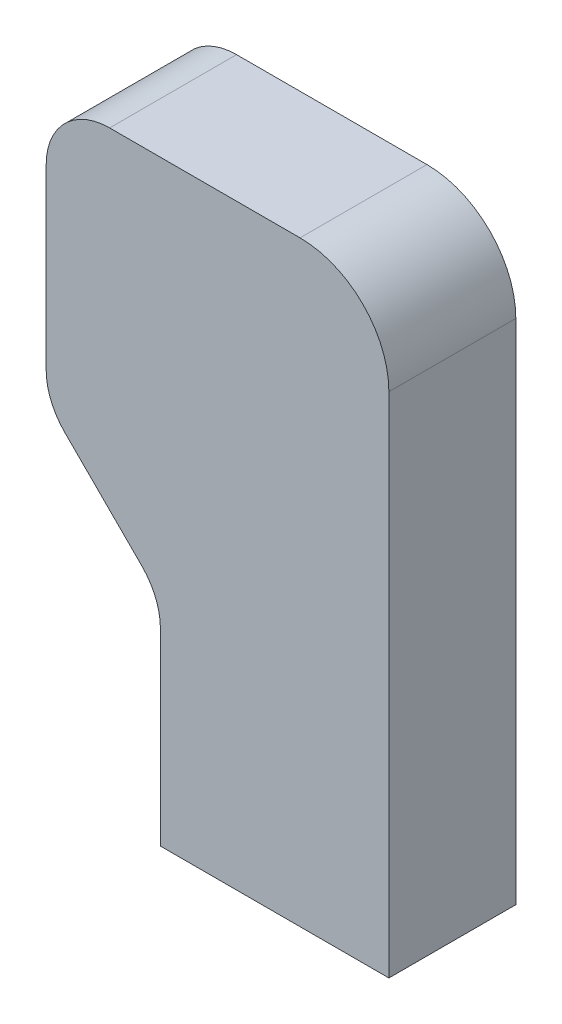
from build123d import *

# Parameters (mm, degrees)
BOSS_EXTRUDE1_DEPTH = 0.635
SKETCH2_W           = 1.27
SKETCH2_H           = 0.76
CUT_EXTRUDE1_DEPTH  = 4.74
FILLET1_R           = 0.635


with BuildPart() as part:
    # Sketch1 → Boss-Extrude1 (new, symmetric)
    with BuildSketch(Plane.XY):
        with BuildLine():
            Line((146.298402351, 141.127858501), (147.069427963, 140.356832889))
            ThreePointArc((147.069427963, 140.356832889), (147.20707866, 140.150824062), (147.255415157, 139.907820083))
            Line((147.255415157, 139.907820083), (147.255415157, 138.021869168))
            Line((147.255415157, 138.021869168), (149.541415157, 138.021869168))
            Line((149.541415157, 138.021869168), (149.541415157, 143.101869168))
            ThreePointArc((149.541415157, 143.101869168), (149.281033086, 143.730487097), (148.652415157, 143.990869168))
            Line((148.652415157, 143.990869168), (146.747415157, 143.990869168))
            ThreePointArc((146.747415157, 143.990869168), (146.298402351, 143.804881974), (146.112415157, 143.355869168))
            Line((146.112415157, 143.355869168), (146.112415157, 141.576871307))
            ThreePointArc((146.112415157, 141.576871307), (146.160751654, 141.333867327), (146.298402351, 141.127858501))
        make_face()
    extrude(amount=BOSS_EXTRUDE1_DEPTH, both=True)

    # Sketch2 → Cut-Extrude1 (cut)
    with BuildSketch(Plane.XZ.offset(-138.021869168)):
        with Locations((148.398415157, 0)):
            Rectangle(SKETCH2_W, SKETCH2_H)
    extrude(amount=-CUT_EXTRUDE1_DEPTH, mode=Mode.SUBTRACT)

    # Fillet1
    fillet1_edges = [part.edges().sort_by_distance(p)[0] for p in [
        (147.763415157, 142.761869168, 0),
        (149.033415157, 142.761869168, 0),
    ]]
    fillet(fillet1_edges, radius=FILLET1_R - 0.0001)  # a hair under: the kernel refuses the full size


solid = part.part
